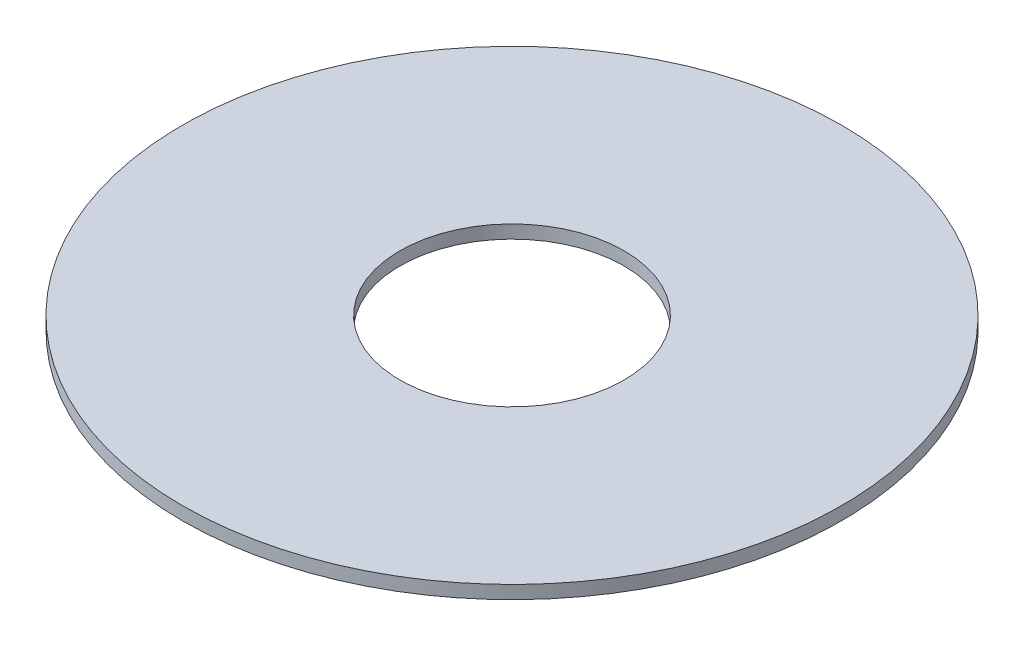
from build123d import *

# Parameters (mm, degrees)
SKETCH1_R           = 19.05
SKETCH1_R_2         = 6.477
BOSS_EXTRUDE1_DEPTH = 0.381


with BuildPart() as part:
    # Sketch1 → Boss-Extrude1 (new, symmetric)
    with BuildSketch(Plane(origin=(0, 0, 0), x_dir=(1, 0, 0), z_dir=(0, 1, 0))):
        Circle(SKETCH1_R)
        Circle(SKETCH1_R_2, mode=Mode.SUBTRACT)
    extrude(amount=BOSS_EXTRUDE1_DEPTH, both=True)


solid = part.part
